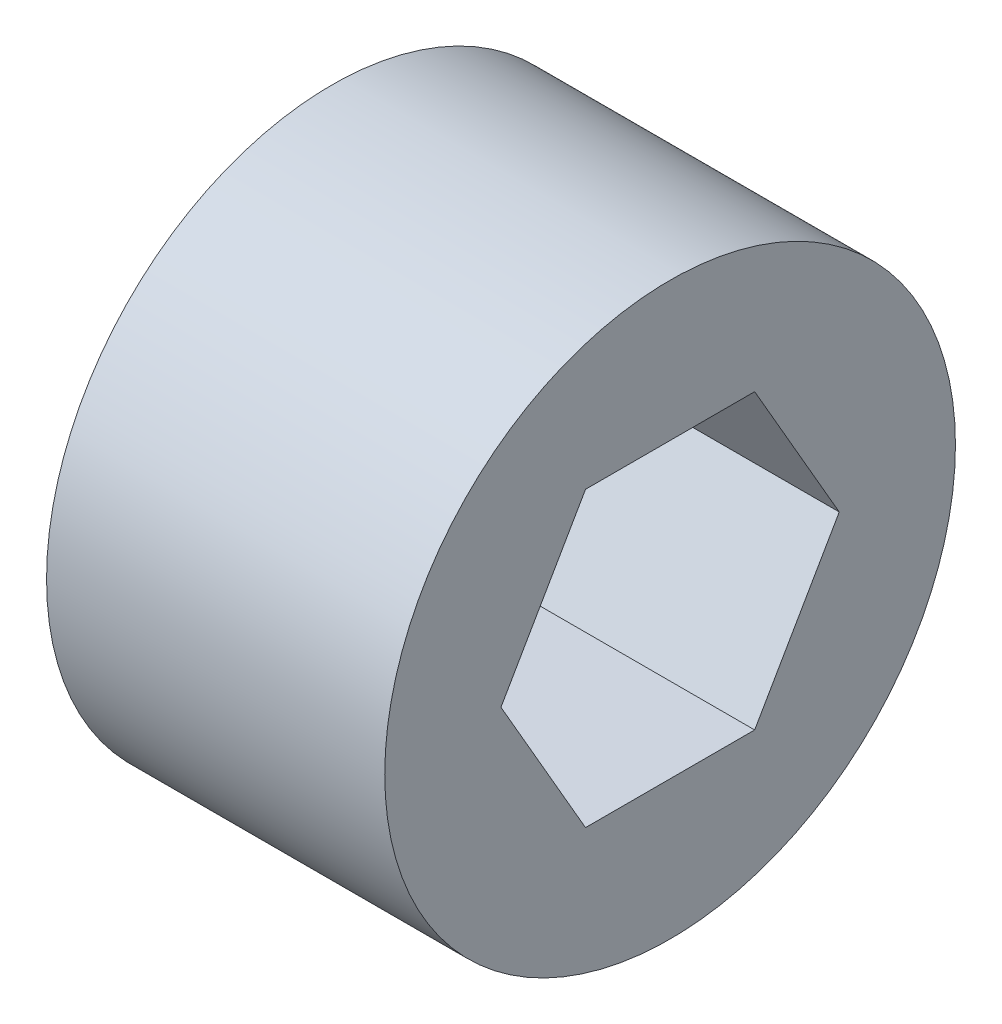
from build123d import *

# Parameters (mm, degrees)
SKETCH1_R           = 9.525
BOSS_EXTRUDE1_DEPTH = 11.288888889


with BuildPart() as part:
    # Sketch1 → Boss-Extrude1 (new body)
    with BuildSketch(Plane(origin=(0, 0, 0), x_dir=(0, 0, -1), z_dir=(1, 0, 0))):
        Circle(SKETCH1_R)
        Polygon((5.645908282, 0), (2.822954141, 4.8895), (-2.822954141, 4.8895), (-5.645908282, 0), (-2.822954141, -4.8895), (2.822954141, -4.8895), align=None, mode=Mode.SUBTRACT)
    extrude(amount=BOSS_EXTRUDE1_DEPTH)


solid = part.part
